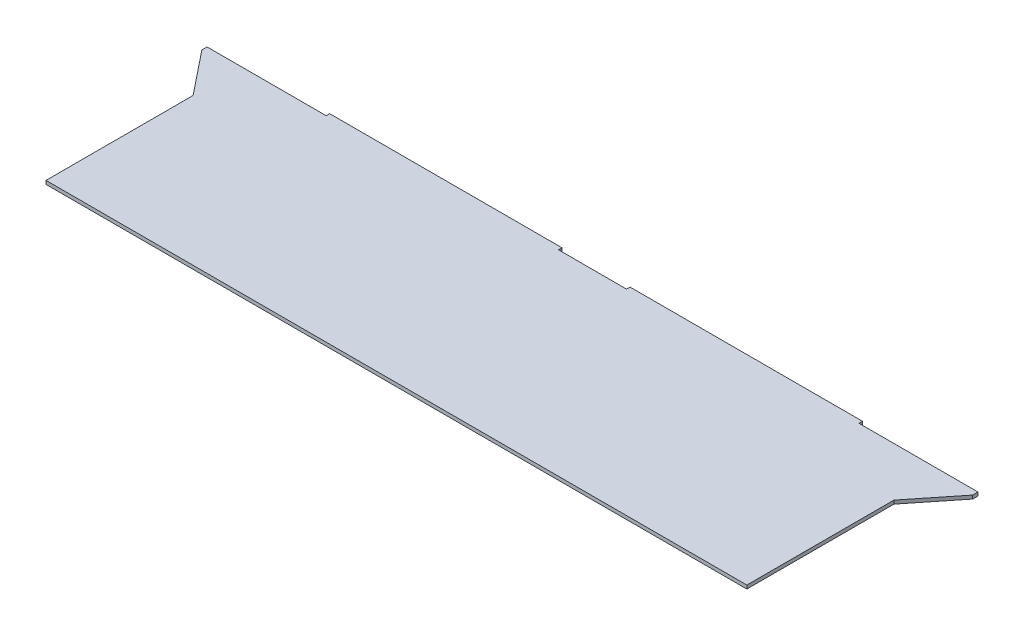
from build123d import *

# Parameters (mm, degrees)
SKETCH1_W           = 635.3556
SKETCH1_H           = 177.8
BOSS_EXTRUDE1_DEPTH = 1.5875
SKETCH2_W           = 210.6549
SKETCH2_H           = 3.175
BOSS_EXTRUDE2_DEPTH = 3.175
BOSS_EXTRUDE3_DEPTH = 3.175


with BuildPart() as part:
    # Sketch1 → Boss-Extrude1 (new, symmetric)
    with BuildSketch(Plane(origin=(0, 0, 0), x_dir=(1, 0, 0), z_dir=(0, 1, 0))):
        Rectangle(SKETCH1_W, SKETCH1_H)
    extrude(amount=BOSS_EXTRUDE1_DEPTH, both=True)

    # Sketch2 → Boss-Extrude2 (add)
    with BuildSketch(Plane(origin=(0, 0, -88.9), x_dir=(-1, 0, 0), z_dir=(0, 0, -1))):
        with Locations((136.15035, 0)):
            Rectangle(SKETCH2_W, SKETCH2_H)
        with Locations((-136.15035, 0)):
            Rectangle(SKETCH2_W, SKETCH2_H)
    extrude(amount=BOSS_EXTRUDE2_DEPTH)

    # Sketch3 → Boss-Extrude3 (add)
    with BuildSketch(Plane(origin=(0, 1.5875, 0), x_dir=(1, 0, 0), z_dir=(0, 1, 0))):
        Polygon((-317.6778, 44.45), (-317.6778, 88.9), (-349.4278, 88.9), (-349.4278, 84.1375), align=None)
    boss_extrude3 = extrude(amount=-BOSS_EXTRUDE3_DEPTH)

    # Mirror1: Boss-Extrude3 across plane
    add(boss_extrude3.mirror(Plane(origin=(0, 0, 0), x_dir=(0, 0, 1), z_dir=(1, 0, 0))))


solid = part.part
